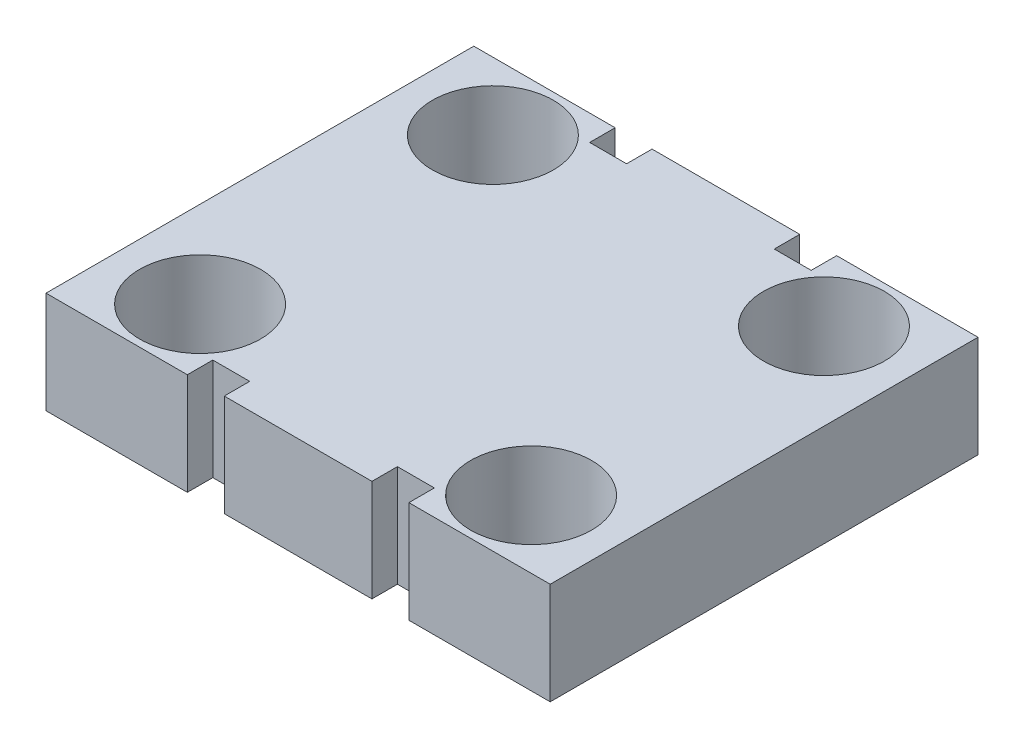
from build123d import *

# Parameters (mm, degrees)
SKETCH1_W           = 40
SKETCH1_H           = 34
BOSS_EXTRUDE1_DEPTH = 8
SKETCH2_R           = 4.75
CUT_EXTRUDE1_DEPTH  = 7
SKETCH3_R           = 5.5
CUT_EXTRUDE2_DEPTH  = 6
SKETCH4_W           = 2.5
SKETCH4_H           = 2
CUT_EXTRUDE3_DEPTH  = 15
CUT_EXTRUDE4_DEPTH  = 54.103672189


with BuildPart() as part:
    # Sketch1 → Boss-Extrude1 (new body)
    with BuildSketch(Plane(origin=(0, 0, 0), x_dir=(1, 0, 0), z_dir=(0, 1, 0))):
        with Locations((-20, 17)):
            Rectangle(SKETCH1_W, SKETCH1_H)
    extrude(amount=BOSS_EXTRUDE1_DEPTH)

    # Sketch2 → Cut-Extrude1 (cut)
    with BuildSketch(Plane(origin=(0, 8, 0), x_dir=(1, 0, 0), z_dir=(0, 1, 0))):
        with Locations((-33, 28.5)):
            Circle(SKETCH2_R)
        with Locations((-33, 5.5)):
            Circle(SKETCH2_R)
        with Locations((-7, 5.5)):
            Circle(SKETCH2_R)
        with Locations((-7, 28.5)):
            Circle(SKETCH2_R)
    extrude(amount=-CUT_EXTRUDE1_DEPTH, mode=Mode.SUBTRACT)

    # Sketch3 → Cut-Extrude2 (cut)
    with BuildSketch(Plane.XZ):
        with Locations((-20, -17)):
            Circle(SKETCH3_R)
    extrude(amount=-CUT_EXTRUDE2_DEPTH, mode=Mode.SUBTRACT)

    # Sketch4 → Cut-Extrude3 (cut)
    with BuildSketch(Plane.XZ):
        with Locations((-12.75, -1)):
            Rectangle(SKETCH4_W, SKETCH4_H)
        with Locations((-27.25, -1)):
            Rectangle(SKETCH4_W, SKETCH4_H)
        with Locations((-12.75, -33)):
            Rectangle(SKETCH4_W, SKETCH4_H)
        with Locations((-27.25, -33)):
            Rectangle(SKETCH4_W, SKETCH4_H)
    extrude(amount=-CUT_EXTRUDE3_DEPTH, mode=Mode.SUBTRACT)

    # Sketch5 → Cut-Extrude4 (cut, through all)
    with BuildSketch(Plane.XZ):
        Polygon((-40, -34), (-28.5, -34), (-28.5, -32), (-26, -32), (-26, -34), (-14, -34), (-14, -32), (-11.5, -32), (-11.5, -34), (0, -34), (0, 0), (-11.5, 0), (-11.5, -2), (-14, -2), (-14, 0), (-26, 0), (-26, -2), (-28.5, -2), (-28.5, 0), (-40, 0), align=None)
        Polygon((-39.8, -33.8), (-28.7, -33.8), (-28.7, -31.8), (-25.8, -31.8), (-25.8, -33.8), (-14.2, -33.8), (-14.2, -31.8), (-11.3, -31.8), (-11.3, -33.8), (-0.2, -33.8), (-0.2, -0.2), (-11.3, -0.2), (-11.3, -2.2), (-14.2, -2.2), (-14.2, -0.2), (-25.8, -0.2), (-25.8, -2.2), (-28.7, -2.2), (-28.7, -0.2), (-39.8, -0.2), align=None, mode=Mode.SUBTRACT)
    extrude(amount=-CUT_EXTRUDE4_DEPTH, mode=Mode.SUBTRACT)


solid = part.part
